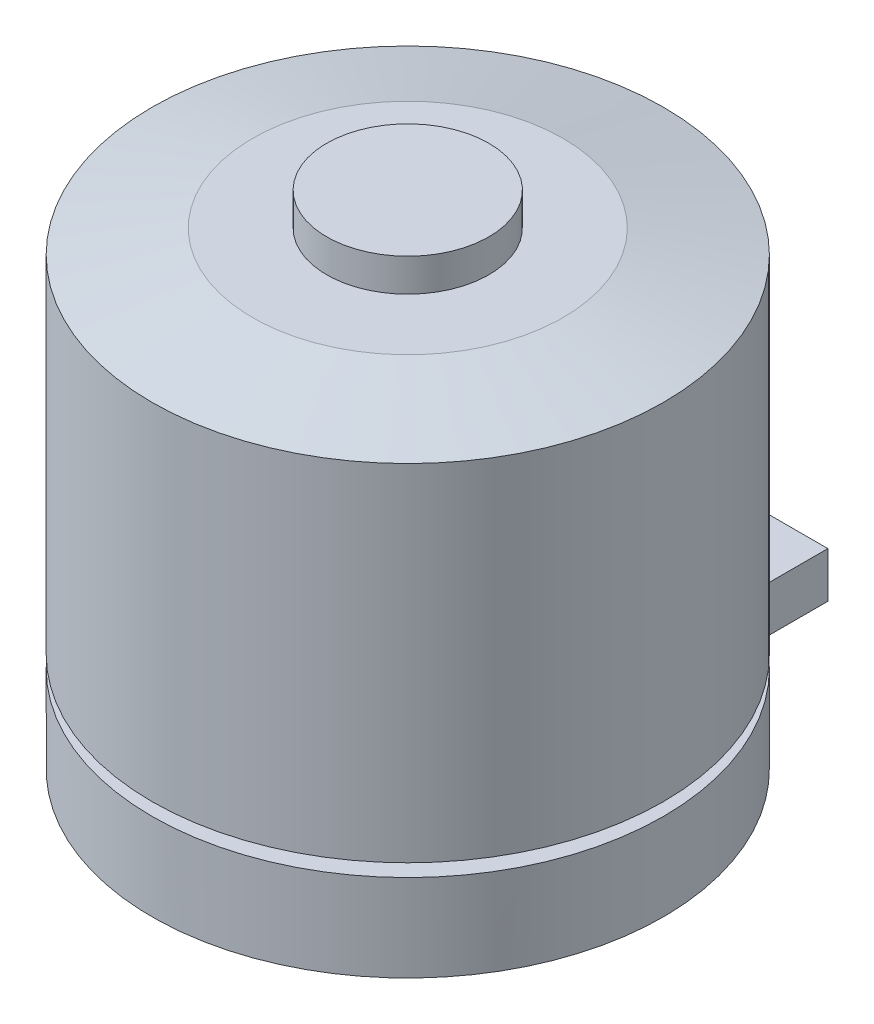
from build123d import *

# Parameters (mm, degrees)
SKETCH2_W                 = 6
SKETCH2_H                 = 2.5
BOSS_EXTRUDE1_DEPTH       = 20
SKETCH3_R                 = 3.75
BOSS_EXTRUDE2_DEPTH       = 1.66
SKETCH4_R                 = 2
BOSS_EXTRUDE3_DEPTH       = 1
M3X0_5_TAPPED_HOLE1_D     = 2.5
M3X0_5_TAPPED_HOLE1_DEPTH = 6
M3X0_5_TAPPED_HOLE1_TIP   = 0.751075774


with BuildPart() as part:
    # Sketch1 → Revolve1 (revolve)
    with BuildSketch(Plane.XY):
        Polygon((0, 29), (4.44, 29), (4.44, 27.2), (8.5, 27.2), (14, 25.930224949), (14, 7), (5.67, 7), (5.67, 6.3), (14, 6.3), (14, 1.535751716), (11.34, 0), (0, 0), align=None)
    revolve(axis=Axis((0, 0, 0), (0, 1, 0)))

    # Sketch2 → Boss-Extrude1 (add)
    with BuildSketch(Plane.XY):
        with Locations((0, 2.25)):
            Rectangle(SKETCH2_W, SKETCH2_H)
    extrude(amount=-BOSS_EXTRUDE1_DEPTH)

    # Sketch3 → Boss-Extrude2 (add)
    with BuildSketch(Plane.XZ):
        Circle(SKETCH3_R)
    extrude(amount=BOSS_EXTRUDE2_DEPTH)

    # Sketch4 → Boss-Extrude3 (add)
    with BuildSketch(Plane.XZ.offset(1.66)):
        Circle(SKETCH4_R)
    extrude(amount=BOSS_EXTRUDE3_DEPTH)

    # M3x0.5 Tapped Hole1
    with Locations(Plane(origin=(0, 0, 0), x_dir=(-1, 0, 0), z_dir=(0, -1, 0))):
        with Locations((6.128355545, 5.142300877), (-6.106482292, 7.27742221), (6.106482292, -7.27742221), (-6.128355545, -5.142300877)):
            Hole(M3X0_5_TAPPED_HOLE1_D / 2, depth=M3X0_5_TAPPED_HOLE1_DEPTH)
            with Locations((0, 0, -(M3X0_5_TAPPED_HOLE1_DEPTH + M3X0_5_TAPPED_HOLE1_TIP / 2))):  # 118° drill point
                Cone(0, M3X0_5_TAPPED_HOLE1_D / 2, M3X0_5_TAPPED_HOLE1_TIP, mode=Mode.SUBTRACT)


solid = part.part
